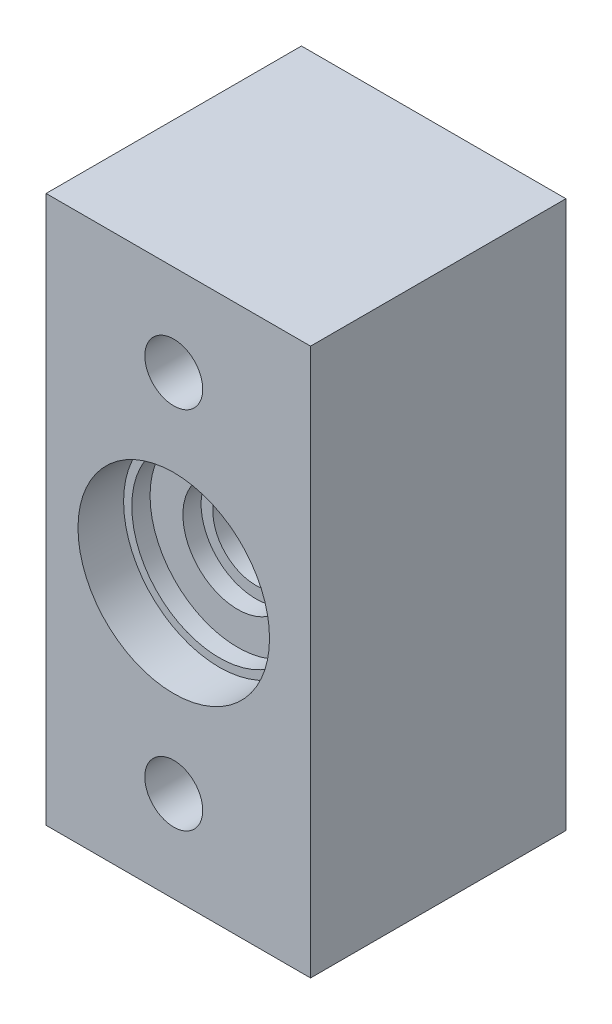
from build123d import *

# Parameters (mm, degrees)
SKETCH1_W               = 15
SKETCH1_H               = 30
BOSS_EXTRUDE1_DEPTH     = 9
SKETCH2_R               = 5.25
CUT_EXTRUDE1_DEPTH      = 2.5
SKETCH4_R               = 4.8
CUT_EXTRUDE3_DEPTH      = 1
CUT_EXTRUDE4_DEPTH      = 18.649362595
CUT_EXTRUDE4_DEPTH_BACK = 5
SKETCH5_R               = 2.36
CUT_EXTRUDE6_DEPTH      = 20.032866311
CUT_EXTRUDE6_DEPTH_BACK = 20.032866311
SKETCH11_W              = 14.5
SKETCH11_H              = 30
BOSS_EXTRUDE5_DEPTH     = 5
SKETCH12_R              = 4
CUT_EXTRUDE8_DEPTH      = 5
SKETCH13_R              = 1.5875
CUT_EXTRUDE9_DEPTH      = 22.846052275
SKETCH14_R              = 3
CUT_EXTRUDE10_DEPTH     = 1


with BuildPart() as part:
    # Sketch1 → Boss-Extrude1 (new body)
    with BuildSketch(Plane.XY):
        Rectangle(SKETCH1_W, SKETCH1_H)
    extrude(amount=BOSS_EXTRUDE1_DEPTH)

    # Sketch2 → Cut-Extrude1 (cut)
    with BuildSketch(Plane.XY.offset(9)):
        Circle(SKETCH2_R)
    extrude(amount=-CUT_EXTRUDE1_DEPTH, mode=Mode.SUBTRACT)

    # Sketch4 → Cut-Extrude3 (cut)
    with BuildSketch(Plane.XY.offset(6.5)):
        Circle(SKETCH4_R)
    extrude(amount=-CUT_EXTRUDE3_DEPTH, mode=Mode.SUBTRACT)

    # Sketch5 → Cut-Extrude4 (cut, two sides: drawn at the far end of the back side and taken through both)
    with BuildSketch(Plane.XY.offset(5.5).offset(-CUT_EXTRUDE4_DEPTH_BACK)):
        Circle(SKETCH5_R)
    extrude(amount=CUT_EXTRUDE4_DEPTH + CUT_EXTRUDE4_DEPTH_BACK, mode=Mode.SUBTRACT)

    # Sketch6 → Cut-Extrude6 (cut, two sides: drawn at the far end of the back side and taken through both)
    with BuildSketch(Plane.XY.offset(-CUT_EXTRUDE6_DEPTH_BACK)):
        Polygon((-7, 91.640828326), (-7, 15), (-7, -15), (-7, -91.640828326), (-160.281656652, -91.640828326), (-160.281656652, 91.640828326), align=None)
    extrude(amount=CUT_EXTRUDE6_DEPTH + CUT_EXTRUDE6_DEPTH_BACK, mode=Mode.SUBTRACT)

    # Sketch11 → Boss-Extrude5 (add)
    with BuildSketch(Plane(origin=(0, 0, 0), x_dir=(-1, 0, 0), z_dir=(0, 0, -1))):
        with Locations((-0.25, 0)):
            Rectangle(SKETCH11_W, SKETCH11_H)
    extrude(amount=BOSS_EXTRUDE5_DEPTH)

    # Sketch12 → Cut-Extrude8 (cut)
    with BuildSketch(Plane(origin=(0, 0, -5), x_dir=(-1, 0, 0), z_dir=(0, 0, -1))):
        Circle(SKETCH12_R)
    extrude(amount=-CUT_EXTRUDE8_DEPTH, mode=Mode.SUBTRACT)

    # Sketch13 → Cut-Extrude9 (cut, through all)
    with BuildSketch(Plane(origin=(0, 0, -5), x_dir=(-1, 0, 0), z_dir=(0, 0, -1))):
        with Locations((0, -10)):
            Circle(SKETCH13_R)
        with Locations((0, 10)):
            Circle(SKETCH13_R)
    extrude(amount=-CUT_EXTRUDE9_DEPTH, mode=Mode.SUBTRACT)

    # Sketch14 → Cut-Extrude10 (cut)
    with BuildSketch(Plane.XY.offset(5.5)):
        Circle(SKETCH14_R)
    extrude(amount=-CUT_EXTRUDE10_DEPTH, mode=Mode.SUBTRACT)


solid = part.part
